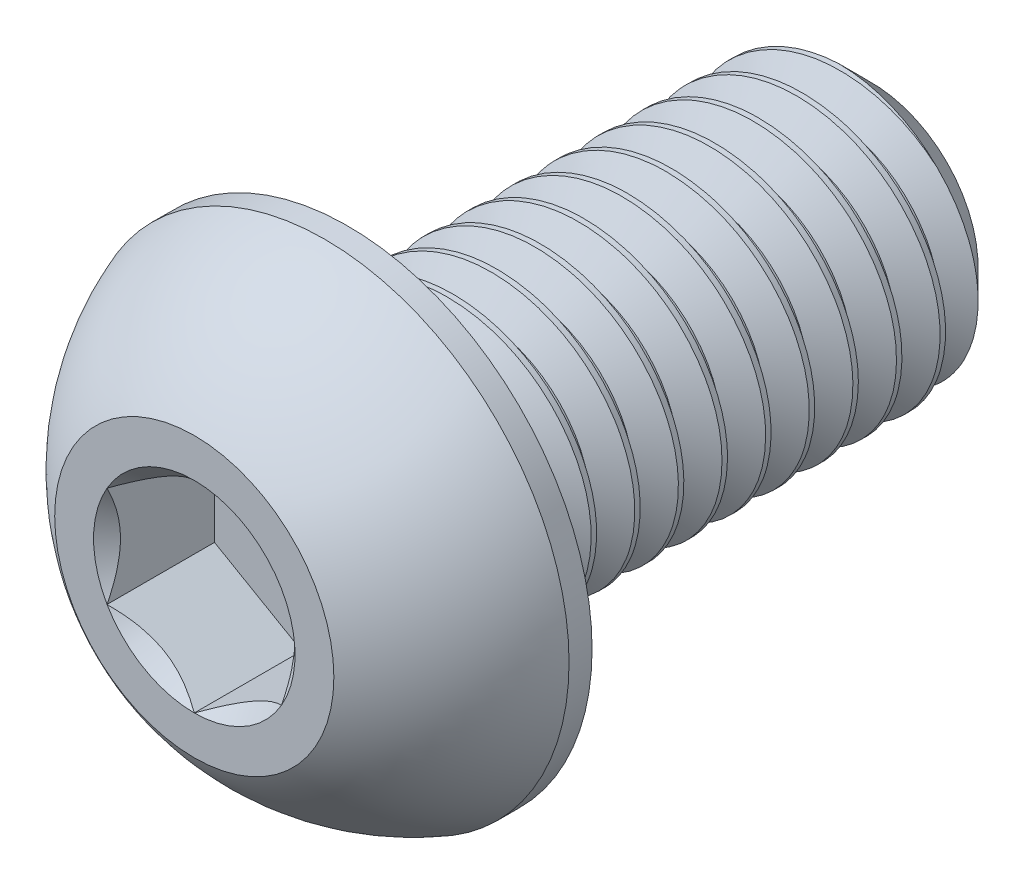
from build123d import *

# Parameters (mm, degrees)
SKETCH1_W          = 15
SKETCH1_H          = 4
CHAMFER1_SIZE      = 0.9375
CUT_EXTRUDE2_DEPTH = 3.08
CUT_SWEEP1_PITCH   = 1.25


with BuildPart() as part:
    # Sketch1 → Revolve1 (revolve)
    with BuildSketch(Plane(origin=(0, 0, 0), x_dir=(0, 0, -1), z_dir=(1, 0, 0)), mode=Mode.PRIVATE) as revolve1_sk:
        with Locations((11.9, 2)):
            Rectangle(SKETCH1_W, SKETCH1_H)
    revolve(revolve1_sk.sketch.rotate(Axis((0, 0, -19.4), (0, 0, 1)), 90), axis=Axis((0, 0, -19.4), (0, 0, 1)))

    # Chamfer1
    chamfer1_edges = [part.edges().sort_by_distance(p)[0] for p in [
        (4, 0, -19.4),
    ]]
    chamfer(chamfer1_edges, length=CHAMFER1_SIZE)

    # Sketch7 → Revolve2 (revolve)
    with BuildSketch(Plane(origin=(0, 0, 0), x_dir=(0, 0, -1), z_dir=(1, 0, 0)), mode=Mode.PRIVATE) as revolve2_sk:
        with BuildLine():
            Line((3.74, 7), (4.4, 7))
            Line((4.4, 7), (4.4, 0))
            Line((4.4, 0), (0, 0))
            Line((0, 0), (0, 4))
            ThreePointArc((0, 4), (1.621972026, 5.809208208), (3.74, 7))
        make_face()
    revolve(revolve2_sk.sketch.rotate(Axis((0, 0, 0), (0, 0, -1)), 180), axis=Axis((0, 0, 0), (0, 0, -1)))

    # Sketch5 → Cut-Extrude2 (cut)
    with BuildSketch(Plane.XY):
        Polygon((2.5, -1.443375673), (2.5, 1.443375673), (0, 2.886751346), (-2.5, 1.443375673), (-2.5, -1.443375673), (0, -2.886751346), align=None)
    extrude(amount=-CUT_EXTRUDE2_DEPTH, mode=Mode.SUBTRACT)

    # Cut-Extrude3 cone 1 section (through the dimple's axis) → Cut-Extrude3 (revolve, cut)
    with BuildSketch(Plane(origin=(0, 0, 0), x_dir=(0, -1, 0), z_dir=(1, 0, 0))):
        Polygon((0, 0), (2.886751346, 0), (0, 2.886751346), align=None)
    revolve(axis=Axis((0, 0, 0), (0, 0, -1)), mode=Mode.SUBTRACT)

    # Cut-Sweep1: the profile of Sketch2 profile screwed along a right-hand helix of 13 turns, 8 arcs to a turn; built about Z, then put on its axis
    cut_sweep1_z = Axis((0, 0, 0), (0, 0, 1))
    cut_sweep1_corners = [(4.0003, 0, 0.937673205), (4.0003, 0, -0.156423205), (3.188101184, 0, 0.3125), (3.188101184, 0, 0.46875)]
    with BuildLine(mode=Mode.PRIVATE) as cut_sweep1_profile:
        Line(cut_sweep1_corners[0], cut_sweep1_corners[1])
        Line(cut_sweep1_corners[1], cut_sweep1_corners[2])
        Line(cut_sweep1_corners[2], cut_sweep1_corners[3])
        Line(cut_sweep1_corners[3], cut_sweep1_corners[0])
    cut_sweep1_cap = Face(cut_sweep1_profile.wire())
    cut_sweep1_turn_angles = [0, 22.5, 45, 67.5, 90, 112.5, 135, 157.5, 180, 202.5, 225, 247.5, 270, 292.5, 315, 337.5, 360]
    cut_sweep1_turn_weights = [1, 0.9238795325112867, 1, 0.9238795325112867, 1, 0.9238795325112867, 1, 0.9238795325112867, 1, 0.9238795325112867, 1, 0.9238795325112867, 1, 0.9238795325112867, 1, 0.9238795325112867, 1]
    cut_sweep1_turn_rails = [Edge.make_bspline([Vector(p[0], p[1], 0).rotate(cut_sweep1_z, cut_sweep1_turn_angles[k]) / cut_sweep1_turn_weights[k] + Vector(0, 0, p[2] + CUT_SWEEP1_PITCH * cut_sweep1_turn_angles[k] / 360) for k in range(17)], [0, 0, 0, 1, 1, 2, 2, 3, 3, 4, 4, 5, 5, 6, 6, 7, 7, 8, 8, 8], 2, cut_sweep1_turn_weights) for p in cut_sweep1_corners]
    cut_sweep1_turn_sides = [Face.make_surface_from_curves(cut_sweep1_turn_rails[p[0]], cut_sweep1_turn_rails[p[1]]) for p in [(0, 1), (1, 2), (2, 3), (3, 0)]]
    cut_sweep1 = Plane(origin=(0, 0, -19.4), x_dir=(0, 1, 0), z_dir=(0, 0, 1)) * Solid(Shell([*[p.moved(Location((0, 0, CUT_SWEEP1_PITCH * i))) for i in range(13) for p in cut_sweep1_turn_sides], cut_sweep1_cap, cut_sweep1_cap.rotate(cut_sweep1_z, 4680).moved(Location((0, 0, CUT_SWEEP1_PITCH * 4680 / 360)))]))
    add(cut_sweep1, mode=Mode.SUBTRACT)


solid = part.part
